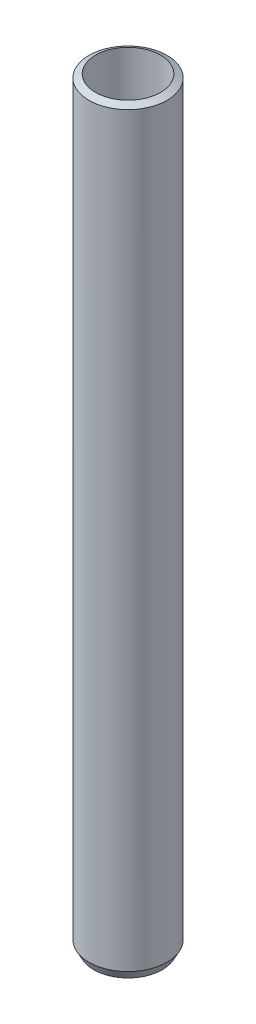
from build123d import *

# Parameters (mm, degrees)
SKETCH1_R           = 30
BOSS_EXTRUDE1_DEPTH = 584.325904
SKETCH2_R           = 24.932403849
CUT_EXTRUDE1_DEPTH  = 586.864115717
CHAMFER1_SIZE       = 3.654156
CHAMFER1_SIZE_2     = 6.838084


with BuildPart() as part:
    # Sketch1 → Boss-Extrude1 (new body)
    with BuildSketch(Plane(origin=(0, 0, 0), x_dir=(1, 0, 0), z_dir=(0, 1, 0))):
        with Locations(Location((0, 0, 0), (0, 0, 270))):
            Circle(SKETCH1_R)
    extrude(amount=BOSS_EXTRUDE1_DEPTH)

    # Sketch2 → Cut-Extrude1 (cut, through all)
    with BuildSketch(Plane(origin=(0, 0, 0), x_dir=(1, 0, 0), z_dir=(0, 1, 0))):
        with Locations(Location((0, 0, 0), (0, 0, 270))):
            Circle(SKETCH2_R)
    extrude(amount=CUT_EXTRUDE1_DEPTH, mode=Mode.SUBTRACT)

    # Chamfer1
    # the kernel refuses this chamfer: 6.838084, 3.654156 mm, written as the material it takes off along each edge
    with BuildSketch(Plane(origin=(0, 584.325904, 0), x_dir=(0, 0, 1), z_dir=(-1, 0, 0))) as chamfer1_piece_1:
        Polygon((30, -CHAMFER1_SIZE), (30 - CHAMFER1_SIZE_2, 0), (30, 0), align=None)
    revolve(axis=Axis((0, 584.325904, 0), (0, 1, 0)), mode=Mode.SUBTRACT)
    with BuildSketch(Plane(origin=(0, 0, 0), x_dir=(0, 0, 1), z_dir=(-1, 0, 0))) as chamfer1_piece_2:
        Polygon((30, CHAMFER1_SIZE_2), (30 - CHAMFER1_SIZE, 0), (30, 0), align=None)
    revolve(axis=Axis((0, 0, 0), (0, 1, 0)), mode=Mode.SUBTRACT)


solid = part.part
